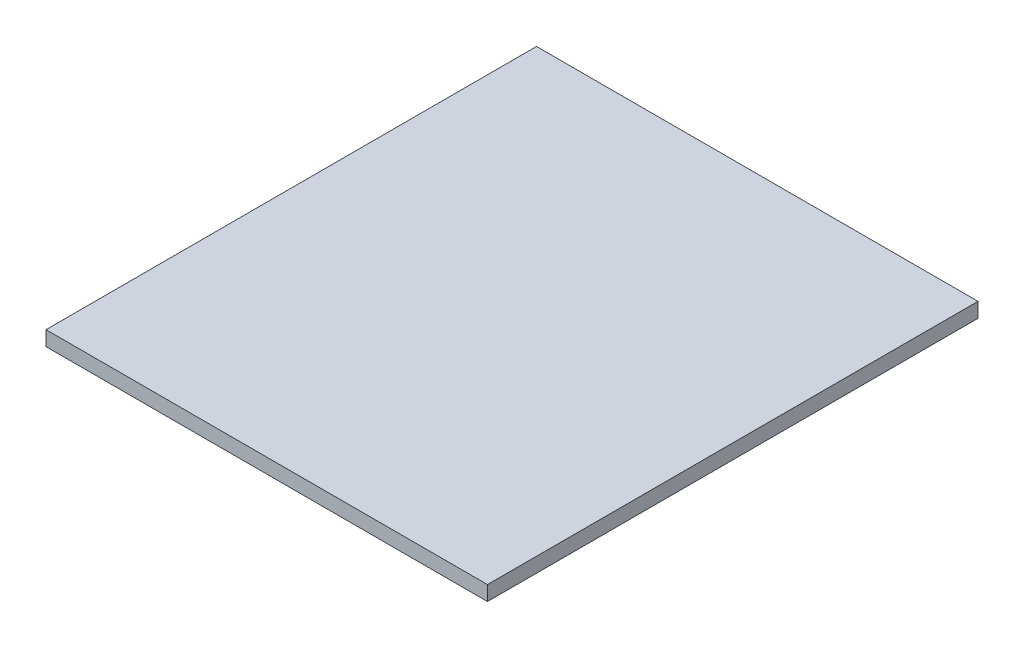
from build123d import *

# Parameters (mm, degrees)
SKETCH1_W           = 90
SKETCH1_H           = 100
BOSS_EXTRUDE1_DEPTH = 3


with BuildPart() as part:
    # Sketch1 → Boss-Extrude1 (new body)
    with BuildSketch(Plane(origin=(0, 0, 0), x_dir=(1, 0, 0), z_dir=(0, 1, 0))):
        with Locations((-45, 0)):
            Rectangle(SKETCH1_W, SKETCH1_H)
    extrude(amount=BOSS_EXTRUDE1_DEPTH)


solid = part.part
